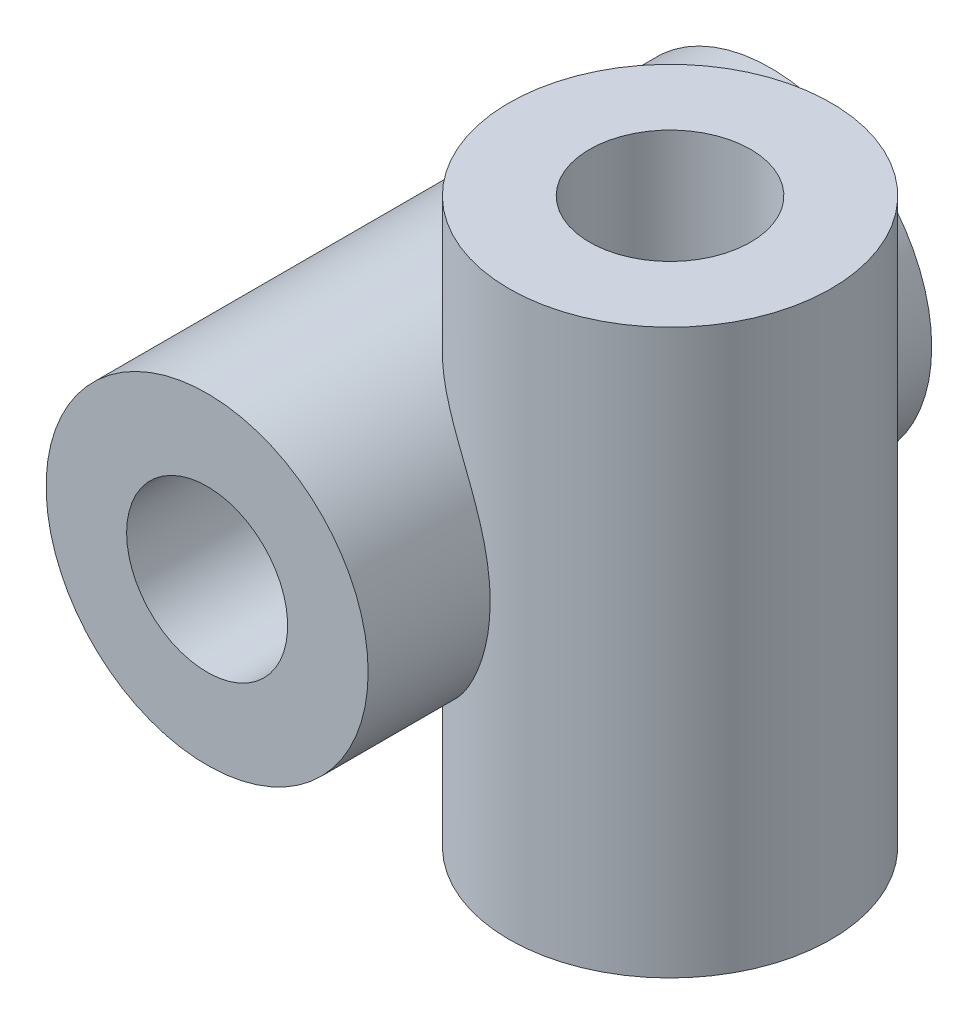
from build123d import *

# Parameters (mm, degrees)
SKETCH1_R           = 16
SKETCH1_R_2         = 8
BOSS_EXTRUDE1_DEPTH = 56
SKETCH2_R           = 16
SKETCH2_R_2         = 8
BOSS_EXTRUDE2_DEPTH = 28
SKETCH3_R           = 8
CUT_EXTRUDE1_DEPTH  = 72.246052688
SKETCH4_R           = 8
CUT_EXTRUDE2_DEPTH  = 87.185845875


with BuildPart() as part:
    # Sketch1 → Boss-Extrude1 (new body)
    with BuildSketch(Plane.XY):
        Circle(SKETCH1_R)
        Circle(SKETCH1_R_2, mode=Mode.SUBTRACT)
    extrude(amount=BOSS_EXTRUDE1_DEPTH)

    # Sketch2 → Boss-Extrude2 (add, symmetric)
    with BuildSketch(Plane(origin=(0, 0, 0), x_dir=(1, 0, 0), z_dir=(0, 1, 0))):
        with Locations((18, -28)):
            Circle(SKETCH2_R)
        with Locations((18, -28)):
            Circle(SKETCH2_R_2, mode=Mode.SUBTRACT)
    extrude(amount=BOSS_EXTRUDE2_DEPTH, both=True)

    # Sketch3 → Cut-Extrude1 (cut, through all)
    with BuildSketch(Plane(origin=(0, 0, 0), x_dir=(-1, 0, 0), z_dir=(0, 0, -1))):
        Circle(SKETCH3_R)
    extrude(amount=-CUT_EXTRUDE1_DEPTH, mode=Mode.SUBTRACT)

    # Sketch4 → Cut-Extrude2 (cut, through all)
    with BuildSketch(Plane.XZ.offset(28)):
        with Locations((18, 28)):
            Circle(SKETCH4_R)
    extrude(amount=-CUT_EXTRUDE2_DEPTH, mode=Mode.SUBTRACT)


solid = part.part
